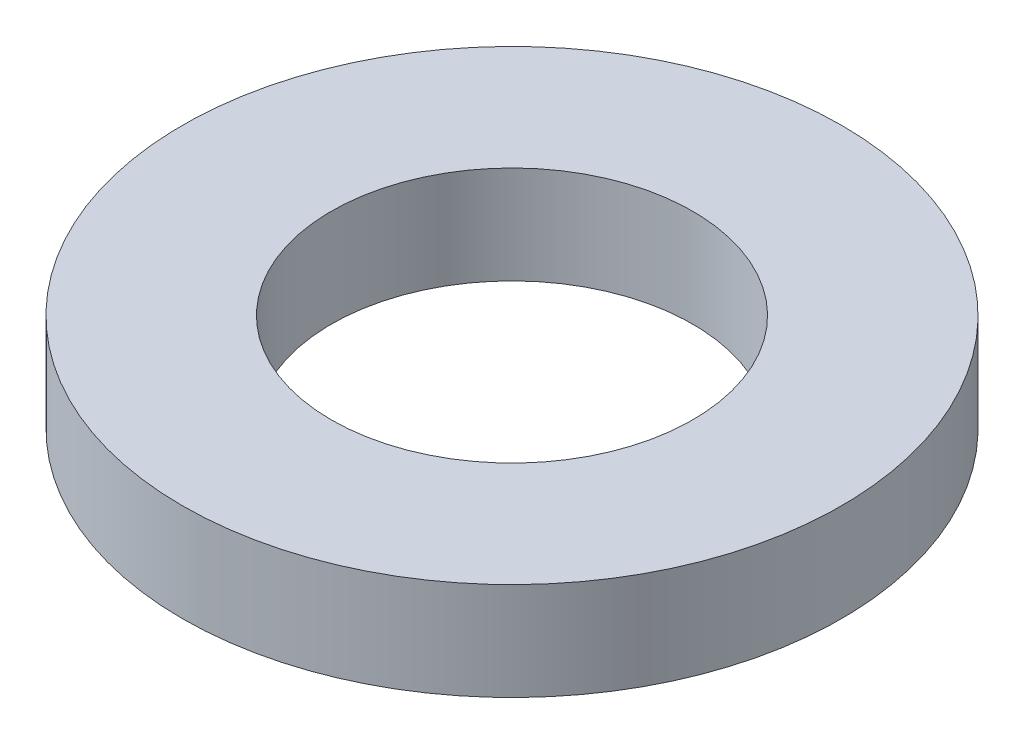
from build123d import *

# Parameters (mm, degrees)
SKETCH1_R           = 77.5
BOSS_EXTRUDE1_DEPTH = 23
SKETCH2_R           = 42.5
CUT_EXTRUDE1_DEPTH  = 112.98883873


with BuildPart() as part:
    # Sketch1 → Boss-Extrude1 (new body)
    with BuildSketch(Plane(origin=(0, 0, 0), x_dir=(1, 0, 0), z_dir=(0, 1, 0))):
        Circle(SKETCH1_R)
    extrude(amount=BOSS_EXTRUDE1_DEPTH)

    # Sketch2 → Cut-Extrude1 (cut, through all)
    with BuildSketch(Plane(origin=(0, 0, 0), x_dir=(1, 0, 0), z_dir=(0, 1, 0))):
        Circle(SKETCH2_R)
    extrude(amount=CUT_EXTRUDE1_DEPTH, mode=Mode.SUBTRACT)


solid = part.part
